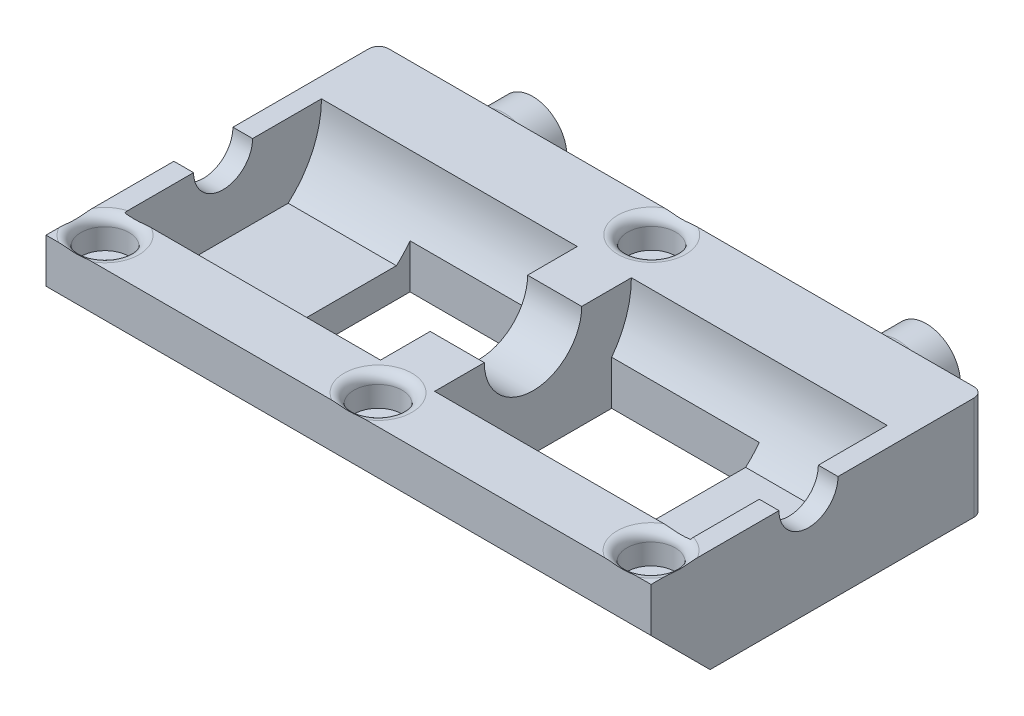
from build123d import *

# Parameters (mm, degrees)
BOSS_EXTRUDE1_DEPTH     = 2
BOSS_EXTRUDE2_DEPTH     = 26
SKETCH2_W               = 33.819718634
SKETCH2_H               = 10.5
BOSS_EXTRUDE3_DEPTH     = 2.75
CUT_EXTRUDE1_START      = -28.75
CUT_EXTRUDE1_DEPTH      = 28.75
SKETCH3_R               = 3.475
BOSS_EXTRUDE6_DEPTH     = 4.9
BOSS_EXTRUDE10_START    = -5
SKETCH3_4_R             = 3.475
BOSS_EXTRUDE10_DEPTH    = 5
FILLET1_R               = 1
FILLET5_R               = 2
CUT_EXTRUDE3_DEPTH      = 38.403183375
CUT_EXTRUDE3_DEPTH_BACK = 38.403183375
SKETCH8_W               = 15
SKETCH8_H               = 16
SKETCH6_3_R             = 2.45
CUT_EXTRUDE4_DEPTH      = 3.1
FILLET8_R               = 1
CHAMFER1_SIZE           = 6


with BuildPart() as part:
    # Sketch1 → Boss-Extrude1 (new body)
    with BuildSketch(Plane(origin=(0, 0, 0), x_dir=(0, 0, -1), z_dir=(1, 0, 0))):
        with BuildLine():
            Line((-16, 0), (-16, -10.5))
            Line((-16, -10.5), (17.819718634, -10.5))
            Line((17.819718634, -10.5), (17.819718634, 0))
            Line((17.819718634, 0), (3, 0))
            ThreePointArc((3, 0), (0, -3), (-3, 0))
            Line((-3, 0), (-16, 0))
        make_face()
    extrude(amount=BOSS_EXTRUDE1_DEPTH)

    # Sketch1<4> → Boss-Extrude2 (add)
    with BuildSketch(Plane(origin=(0, 0, 0), x_dir=(0, 0, -1), z_dir=(1, 0, 0))):
        with BuildLine():
            ThreePointArc((10, 0), (9.114378278, -4.114378278), (6.614378278, -7.5))
            Line((6.614378278, -7.5), (-6.614378278, -7.5))
            ThreePointArc((-6.614378278, -7.5), (-9.114378278, -4.114378278), (-10, 0))
            Line((-10, 0), (-16, 0))
            Line((-16, 0), (-16, -10.5))
            Line((-16, -10.5), (17.819718634, -10.5))
            Line((17.819718634, -10.5), (17.819718634, 0))
            Line((17.819718634, 0), (10, 0))
        make_face()
    extrude(amount=-BOSS_EXTRUDE2_DEPTH)

    # Sketch2 → Boss-Extrude3 (add)
    with BuildSketch(Plane.ZY.offset(26)):
        with Locations((-0.909859317, -5.25)):
            Rectangle(SKETCH2_W, SKETCH2_H)
    extrude(amount=BOSS_EXTRUDE3_DEPTH)

    # Sketch1<6> → Cut-Extrude1 (cut)
    with BuildSketch(Plane(origin=(0, 0, 0), x_dir=(0, 0, -1), z_dir=(1, 0, 0)).offset(CUT_EXTRUDE1_START)):
        with BuildLine():
            Line((-3, 0), (-4.95, 0))
            ThreePointArc((-4.95, 0), (-4.392632865, -2.281945773), (-2.846049894, -4.05))
            Line((-2.846049894, -4.05), (0, -4.05))
            Line((0, -4.05), (0, -3))
            ThreePointArc((0, -3), (-2.121320344, -2.121320344), (-3, 0))
        make_face()
        with BuildLine():
            ThreePointArc((2.846049894, -4.05), (4.392632865, -2.281945773), (4.95, 0))
            Line((4.95, 0), (3, 0))
            ThreePointArc((3, 0), (2.121320344, -2.121320344), (0, -3))
            Line((0, -3), (0, -4.05))
            Line((0, -4.05), (2.846049894, -4.05))
        make_face()
        with BuildLine():
            ThreePointArc((0, 4.95), (-3.500178567, 3.500178567), (-4.95, 0))
            Line((-4.95, 0), (-3, 0))
            ThreePointArc((-3, 0), (-2.121320344, 2.121320344), (0, 3))
            Line((0, 3), (0, 4.95))
        make_face()
        with BuildLine():
            Line((3, 0), (4.95, 0))
            ThreePointArc((4.95, 0), (3.500178567, 3.500178567), (0, 4.95))
            Line((0, 4.95), (0, 3))
            ThreePointArc((0, 3), (2.121320344, 2.121320344), (3, 0))
        make_face()
        with BuildLine():
            ThreePointArc((0, -3), (2.121320344, -2.121320344), (3, 0))
            Line((3, 0), (0, 0))
            Line((0, 0), (0, -3))
        make_face()
        with BuildLine():
            Line((0, 0), (3, 0))
            ThreePointArc((3, 0), (2.121320344, 2.121320344), (0, 3))
            Line((0, 3), (0, 0))
        make_face()
        with BuildLine():
            ThreePointArc((0, 3), (-2.121320344, 2.121320344), (-3, 0))
            Line((-3, 0), (0, 0))
            Line((0, 0), (0, 3))
        make_face()
        with BuildLine():
            Line((0, 0), (-3, 0))
            ThreePointArc((-3, 0), (-2.121320344, -2.121320344), (0, -3))
            Line((0, -3), (0, 0))
        make_face()
        with BuildLine():
            Line((0, -4.05), (-2.846049894, -4.05))
            ThreePointArc((-2.846049894, -4.05), (0, -4.95), (2.846049894, -4.05))
            Line((2.846049894, -4.05), (0, -4.05))
        make_face()
    extrude(amount=CUT_EXTRUDE1_DEPTH, mode=Mode.SUBTRACT)

    # Sketch3 → Boss-Extrude6 (add)
    with BuildSketch(Plane(origin=(0, 0, -17.819718634), x_dir=(-1, 0, 0), z_dir=(0, 0, -1))):
        with Locations(Location((8.75, -5.25, 0), (0, 0, 90))):
            Circle(SKETCH3_R)
    extrude(amount=BOSS_EXTRUDE6_DEPTH)

    # Sketch3<4> → Boss-Extrude10 (add)
    with BuildSketch(Plane(origin=(0, 0, -17.819718634), x_dir=(-1, 0, 0), z_dir=(0, 0, -1)).offset(BOSS_EXTRUDE10_START)):
        with Locations(Location((8.75, -5.25, 0), (0, 0, 90))):
            Circle(SKETCH3_4_R)
    extrude(amount=BOSS_EXTRUDE10_DEPTH)

    # Fillet1
    fillet1_edges = [part.edges().sort_by_distance(p)[0] for p in [
        (2, -5.25, -17.819718634),
    ]]
    fillet(fillet1_edges, radius=FILLET1_R)

    # Fillet5
    fillet5_edges = [part.edges().sort_by_distance(p)[0] for p in [
        (-8.75, -8.725, -17.819718634),
    ]]
    fillet(fillet5_edges, radius=FILLET5_R)

    # Sketch8 → Cut-Extrude3 (cut, two sides: drawn at the far end of the back side and taken through both)
    with BuildSketch(Plane(origin=(0, -7.5, 0), x_dir=(1, 0, 0), z_dir=(0, 1, 0)).offset(-CUT_EXTRUDE3_DEPTH_BACK)):
        with Locations((-18.5, 0)):
            Rectangle(SKETCH8_W, SKETCH8_H)
    extrude(amount=CUT_EXTRUDE3_DEPTH + CUT_EXTRUDE3_DEPTH_BACK, mode=Mode.SUBTRACT)

    # Mirror8: part across plane


with BuildPart() as part_1:
    add(part.part)
    add(part.part.mirror(Plane.ZY.offset(28.75)))

    # Sketch6<3> → Cut-Extrude4 (cut)
    with BuildSketch(Plane(origin=(0, 0, 0), x_dir=(1, 0, 0), z_dir=(0, 1, 0))):
        with Locations(Location((-28.75, 14.819718634, 0), (0, 0, 270))):
            Circle(SKETCH6_3_R)
        with Locations(Location((-1, -13, 0), (0, 0, 270))):
            Circle(SKETCH6_3_R)
        with Locations(Location((-28.75, -13, 0), (0, 0, 270))):
            Circle(SKETCH6_3_R)
        with Locations(Location((-56.5, -13, 0), (0, 0, 270))):
            Circle(SKETCH6_3_R)
    extrude(amount=-CUT_EXTRUDE4_DEPTH, mode=Mode.SUBTRACT)

    # Fillet8
    # the kernel refuses this fillet: 1 mm, written as the material it takes off along each edge
    with BuildSketch(Plane(origin=(-56.5, 0, 13), x_dir=(0, 0, 1), z_dir=(-1, 0, 0))) as fillet8_piece_1:
        with BuildLine():
            CenterArc((2.45 + FILLET8_R, -FILLET8_R), FILLET8_R, 90, 90)
            Line((2.45, -FILLET8_R), (2.45, 0))
            Line((2.45, 0), (2.45 + FILLET8_R, 0))
        make_face()
    revolve(axis=Axis((-56.5, 0, 13), (0, 1, 0)), mode=Mode.SUBTRACT)
    with BuildSketch(Plane(origin=(-28.75, 0, 13), x_dir=(0, 0, 1), z_dir=(-1, 0, 0))) as fillet8_piece_2:
        with BuildLine():
            CenterArc((2.45 + FILLET8_R, -FILLET8_R), FILLET8_R, 90, 90)
            Line((2.45, -FILLET8_R), (2.45, 0))
            Line((2.45, 0), (2.45 + FILLET8_R, 0))
        make_face()
    revolve(axis=Axis((-28.75, 0, 13), (0, 1, 0)), mode=Mode.SUBTRACT)
    with BuildSketch(Plane(origin=(-28.75, 0, -14.819718634), x_dir=(0, 0, 1), z_dir=(-1, 0, 0))) as fillet8_piece_3:
        with BuildLine():
            CenterArc((2.45 + FILLET8_R, -FILLET8_R), FILLET8_R, 90, 90)
            Line((2.45, -FILLET8_R), (2.45, 0))
            Line((2.45, 0), (2.45 + FILLET8_R, 0))
        make_face()
    revolve(axis=Axis((-28.75, 0, -14.819718634), (0, 1, 0)), mode=Mode.SUBTRACT)
    with BuildSketch(Plane(origin=(-1, 0, 13), x_dir=(0, 0, 1), z_dir=(-1, 0, 0))) as fillet8_piece_4:
        with BuildLine():
            CenterArc((2.45 + FILLET8_R, -FILLET8_R), FILLET8_R, 90, 90)
            Line((2.45, -FILLET8_R), (2.45, 0))
            Line((2.45, 0), (2.45 + FILLET8_R, 0))
        make_face()
    revolve(axis=Axis((-1, 0, 13), (0, 1, 0)), mode=Mode.SUBTRACT)

    # Chamfer1
    chamfer1_edges = [part_1.edges().sort_by_distance(p)[0] for p in [
        (-28.75, -10.5, 16),
    ]]
    chamfer(chamfer1_edges, length=CHAMFER1_SIZE)


solid = part_1.part
